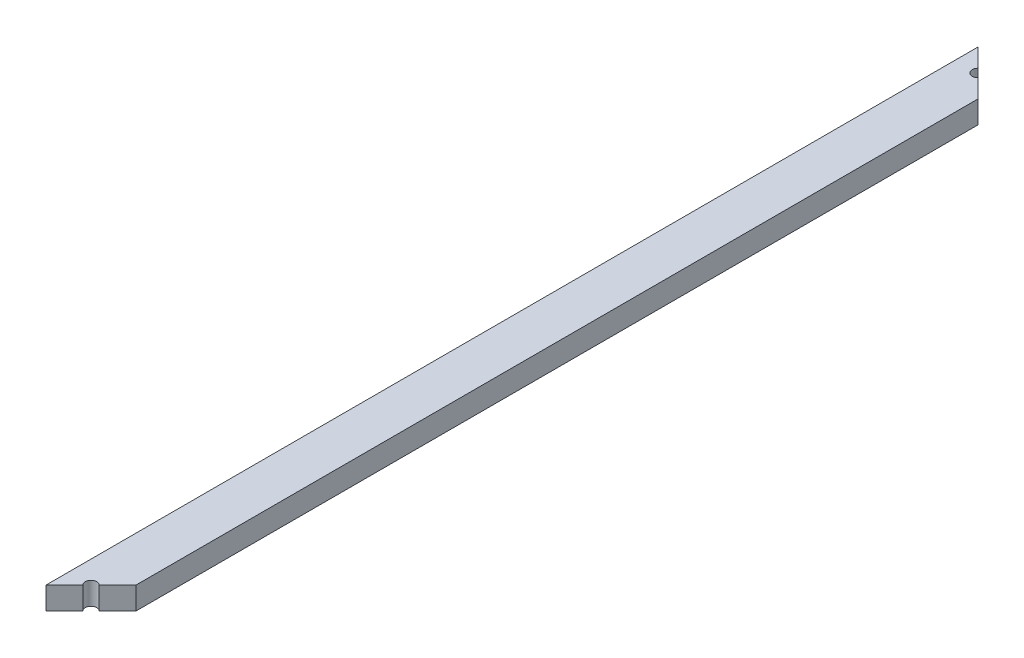
from build123d import *

# Parameters (mm, degrees)
SKETCH1_W           = 14
SKETCH1_H           = 7
BOSS_EXTRUDE1_DEPTH = 290
CUT_EXTRUDE1_DEPTH  = 291.422106597
CUT_EXTRUDE2_DEPTH  = 291.422106597


with BuildPart() as part:
    # Sketch1 → Boss-Extrude1 (new body)
    with BuildSketch(Plane.XY):
        with Locations((7, 3.5)):
            Rectangle(SKETCH1_W, SKETCH1_H)
    extrude(amount=BOSS_EXTRUDE1_DEPTH)

    # Sketch2 → Cut-Extrude1 (cut, through all)
    with BuildSketch(Plane(origin=(0, 7, 0), x_dir=(1, 0, 0), z_dir=(0, 1, 0))):
        Polygon((0, 0), (14, -14), (14, 0), align=None)
        Polygon((14, -290), (0, -290), (14, -276), align=None)
    extrude(amount=-CUT_EXTRUDE1_DEPTH, mode=Mode.SUBTRACT)

    # Sketch3 → Cut-Extrude2 (cut, through all)
    with BuildSketch(Plane(origin=(0, 7, 0), x_dir=(1, 0, 0), z_dir=(0, 1, 0))):
        with BuildLine():
            Line((5.727207794, -5.727207794), (8.272792206, -8.272792206))
            ThreePointArc((8.272792206, -8.272792206), (5.727207794, -8.272792206), (5.727207794, -5.727207794))
        make_face()
        with BuildLine():
            Line((5.727207794, -284.272792206), (8.272792206, -281.727207794))
            ThreePointArc((8.272792206, -281.727207794), (5.727207794, -281.727207794), (5.727207794, -284.272792206))
        make_face()
    extrude(amount=-CUT_EXTRUDE2_DEPTH, mode=Mode.SUBTRACT)


solid = part.part
